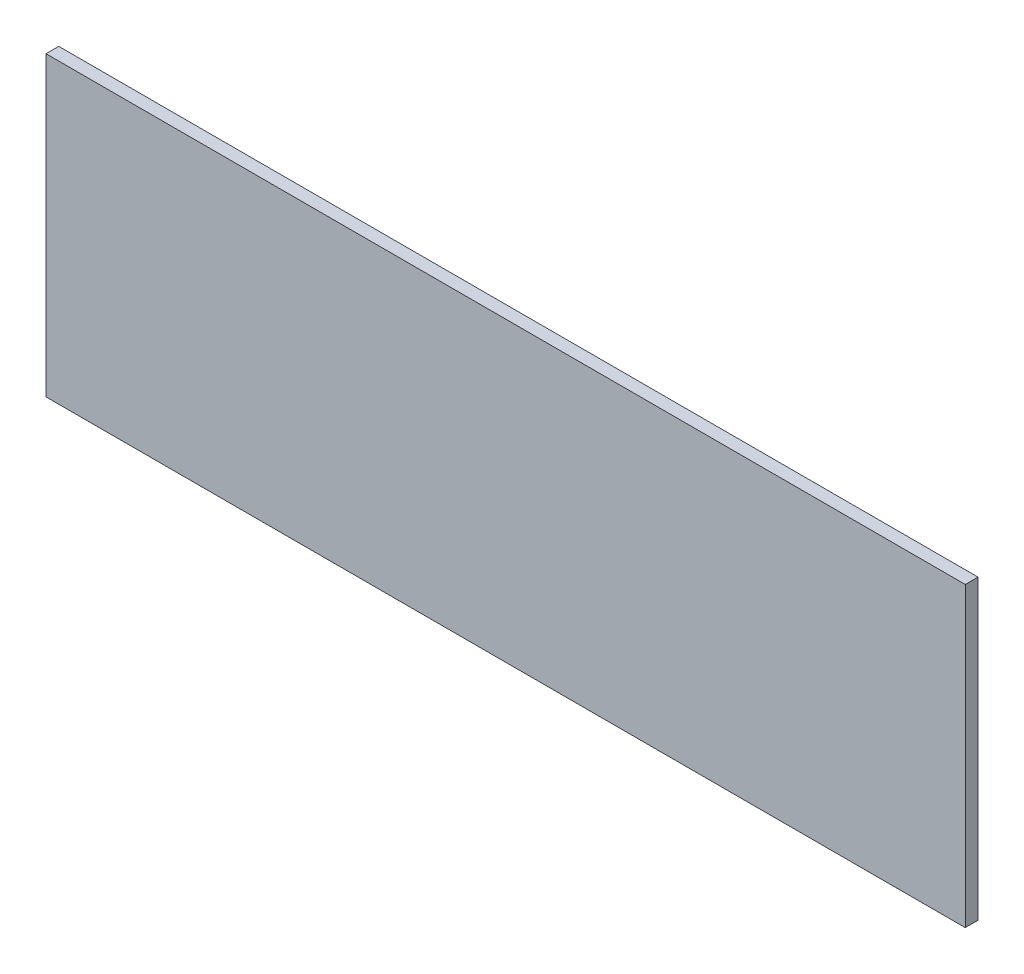
from build123d import *

# Parameters (mm, degrees)
SKETCH1_W           = 433
SKETCH1_H           = 140
BOSS_EXTRUDE1_DEPTH = 6


with BuildPart() as part:
    # Sketch1 → Boss-Extrude1 (new body)
    with BuildSketch(Plane.XY):
        with Locations((222.5, 180)):
            Rectangle(SKETCH1_W, SKETCH1_H)
    extrude(amount=-BOSS_EXTRUDE1_DEPTH)


solid = part.part
